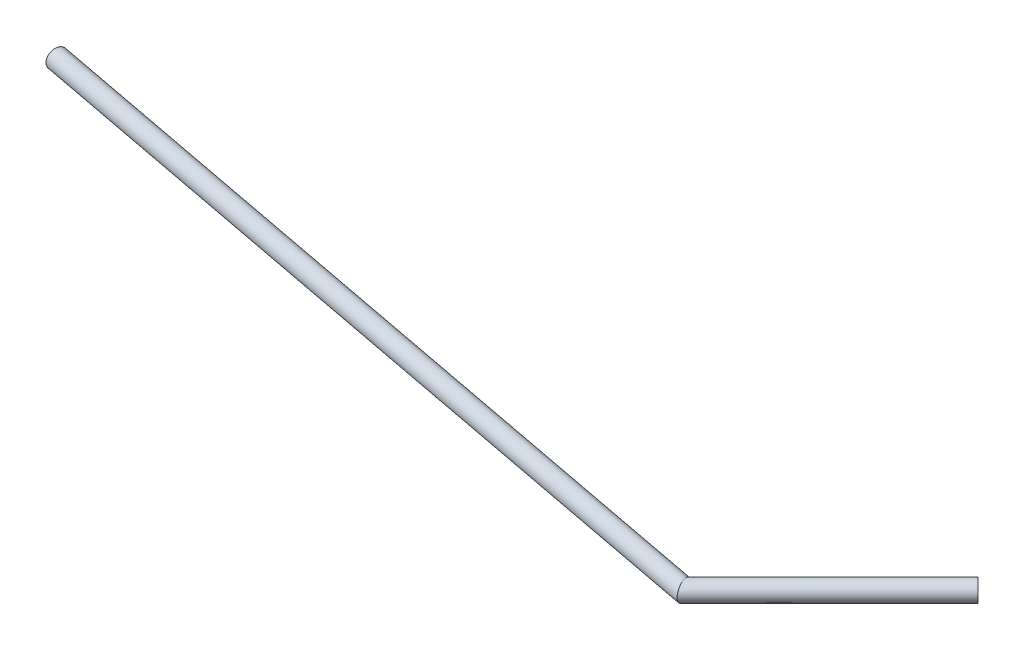
from build123d import *

# Parameters (mm, degrees)
SKETCH2_R   = 9.525
SKETCH2_R_2 = 8.525


with BuildPart() as part:
    # Sweep-Thin1: sweep along a path in Sketch1
    with BuildLine(Plane(origin=(0, 0, 0), x_dir=(1, 0, 0), z_dir=(0, 1, 0))) as sweep_thin1_path:
        Line((470, 0), (320, -150))
        Line((320, -150), (-470, 0))
    # Sketch2 → Sweep-Thin1 (sweep)
    with BuildSketch(Plane(origin=(-470, 0, 0), x_dir=(0.1865406170087326, 0, -0.9824472495793357), z_dir=(0.9824472495793356, 0, 0.18654061700873256))):
        Circle(SKETCH2_R)
        Circle(SKETCH2_R_2, mode=Mode.SUBTRACT)
    sweep(path=sweep_thin1_path.line, transition=Transition.RIGHT)


solid = part.part
